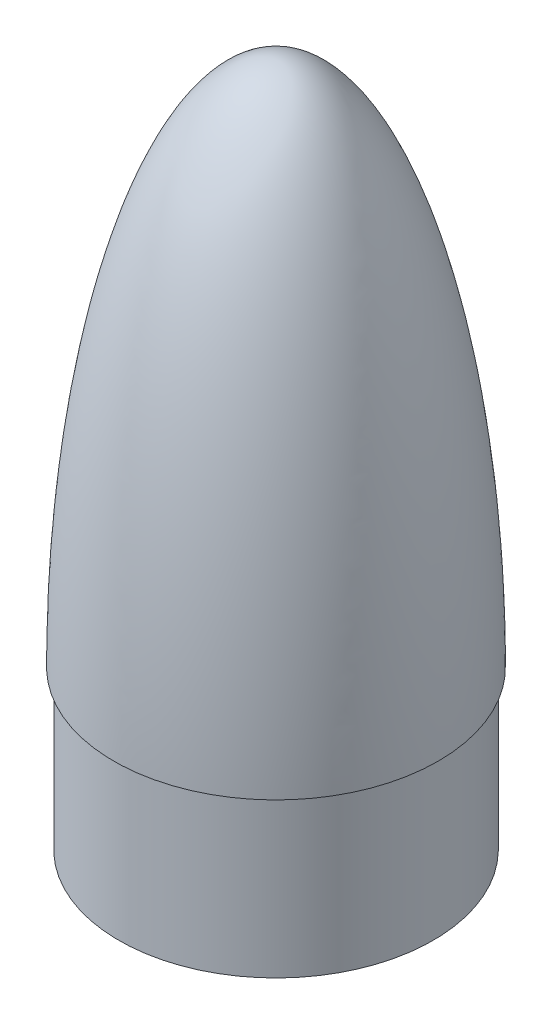
from build123d import *

# Parameters (mm, degrees)
SKETCH2_R           = 75.9206
BOSS_EXTRUDE1_DEPTH = 76.2
SKETCH4_R           = 17.78
CUT_EXTRUDE1_DEPTH  = 96.52
CUT_EXTRUDE2_START  = 106.68
SKETCH5_R           = 8.255
CUT_EXTRUDE2_DEPTH  = 119.38
CUT_EXTRUDE3_START  = -25.4
SKETCH19_R          = 15.24
CUT_EXTRUDE3_DEPTH  = 101.6
SKETCH21_R          = 2.6035
CUT_EXTRUDE4_DEPTH  = 10.16
SKETCH22_R          = 2.6035
CUT_EXTRUDE5_DEPTH  = 10.16


with BuildPart() as part:
    # Sketch1 → Revolve1 (revolve)
    with BuildSketch(Plane.XY):
        with BuildLine():
            Line((78.359, 0), (0, 0))
            Line((0, 0), (0, 254))
            add(Edge.make_bspline(
                [(78.359, 0), (78.359, 0.547287489), (78.357845602, 1.649563618), (78.352650776, 3.586349875), (78.338796346, 5.988934596), (78.318010672, 8.352211569), (78.29028895, 10.745600888), (78.246958697, 13.731411826), (78.181061307, 17.311703382), (78.08386626, 21.490442467), (77.944822085, 26.264117007), (77.777683186, 31.037557631), (77.58229134, 35.809557456), (77.358460439, 40.580511863), (77.042853487, 46.542286246), (76.679080298, 52.501436144), (76.266448568, 58.457359127), (75.804102806, 64.409607399), (75.404015228, 69.168949637), (74.865626928, 75.114798701), (74.157385744, 82.243973993), (73.238266918, 90.551730955), (72.055740597, 100.030771811), (70.735528943, 109.491671534), (69.270929118, 118.931305028), (67.249996919, 130.699881306), (64.501732948, 144.763840427), (61.308555538, 158.735984092), (57.591049496, 172.577213574), (53.383025938, 186.275905479), (49.238746312, 198.044837449), (44.48323743, 209.587335711), (38.942884235, 220.71924179), (34.256173135, 228.693595393), (29.818710248, 235.095423042), (25.624249732, 240.182852143), (21.978892835, 243.926180276), (18.570150197, 246.859542723), (15.474349081, 249.076247661), (12.563405711, 250.785701438), (9.772327363, 252.083533871), (7.063069709, 253.028642362), (4.275373805, 253.686778481), (2.188006886, 253.939891173), (0.767171586, 253.999916555), (0, 254)],
                knots=[0.083290168, 0.083290168, 0.083290168, 0.083290168, 0.083290168, 0.091119674, 0.09894918, 0.106778686, 0.114608192, 0.122437698, 0.130267203, 0.145926215, 0.161585227, 0.177244239, 0.192903251, 0.208562263, 0.224221275, 0.239880287, 0.27119831, 0.286857322, 0.302516334, 0.318175346, 0.333834359, 0.365152383, 0.396470407, 0.42778843, 0.459106453, 0.490424474, 0.521742495, 0.584378539, 0.647014581, 0.678332609, 0.709650637, 0.772286631, 0.810589211, 0.841907031, 0.872607503, 0.893486158, 0.91262845, 0.928287274, 0.941044948, 0.952387223, 0.962498308, 0.97249612, 0.981348672, 0.989949856, 1, 1, 1, 1, 1], degree=4))
        make_face()
    revolve(axis=Axis((0, 254, 0), (0, -1, 0)))

    # Sketch2 → Boss-Extrude1 (add)
    with BuildSketch(Plane.XZ):
        Circle(SKETCH2_R)
    extrude(amount=BOSS_EXTRUDE1_DEPTH)

    # Sketch4 → Cut-Extrude1 (cut)
    with BuildSketch(Plane(origin=(0, 0, 0), x_dir=(1, 0, 0), z_dir=(0, 1, 0))):
        with Locations((48.26, 0)):
            Circle(SKETCH4_R)
        with Locations((0, -48.26)):
            Circle(SKETCH4_R)
        with Locations((-48.26, 0)):
            Circle(SKETCH4_R)
        with Locations((0, 48.26)):
            Circle(SKETCH4_R)
    extrude(amount=CUT_EXTRUDE1_DEPTH, mode=Mode.SUBTRACT)

    # Sketch5 → Cut-Extrude2 (cut)
    with BuildSketch(Plane(origin=(0, 0, 0), x_dir=(1, 0, 0), z_dir=(0, 1, 0)).offset(CUT_EXTRUDE2_START)):
        with Locations((20.32, 0)):
            Circle(SKETCH5_R)
        with Locations((10.16, -17.597636205)):
            Circle(SKETCH5_R)
        with Locations((-10.16, -17.597636205)):
            Circle(SKETCH5_R)
        with Locations((-20.32, 0)):
            Circle(SKETCH5_R)
        with Locations((-10.16, 17.597636205)):
            Circle(SKETCH5_R)
        with Locations((10.16, 17.597636205)):
            Circle(SKETCH5_R)
    extrude(amount=CUT_EXTRUDE2_DEPTH, mode=Mode.SUBTRACT)

    # Sketch6 → Cut-Revolve2 (revolve, cut)
    with BuildSketch(Plane.XY):
        Polygon((-30.48, 96.52), (-48.26, 117.709378876), (-48.26, 96.52), align=None)
    revolve(axis=Axis((-48.26, 96.52, 0), (0, -1, 0)), mode=Mode.SUBTRACT)

    # Sketch8 → Cut-Revolve4 (revolve, cut)
    with BuildSketch(Plane.XY.offset(48.26)):
        Polygon((0, 96.52), (17.78, 96.52), (0, 117.709378876), align=None)
    revolve(axis=Axis((0, 96.52, 48.26), (0, -1, 0)), mode=Mode.SUBTRACT)

    # Sketch9 → Cut-Revolve5 (revolve, cut)
    with BuildSketch(Plane.XY):
        Polygon((48.26, 96.52), (66.04, 96.52), (48.26, 117.709378876), align=None)
    revolve(axis=Axis((48.26, 96.52, 0), (0, -1, 0)), mode=Mode.SUBTRACT)

    # Sketch11 → Cut-Revolve6 (revolve, cut)
    with BuildSketch(Plane.XY.offset(-48.26)):
        Polygon((0, 96.52), (17.78, 96.52), (0, 117.709378876), align=None)
    revolve(axis=Axis((0, 96.52, -48.26), (0, -1, 0)), mode=Mode.SUBTRACT)

    # Sketch12 → Cut-Revolve7 (revolve, cut)
    with BuildSketch(Plane.XY):
        Polygon((-20.32, 226.06), (-12.065, 226.06), (-20.32, 235.897925907), align=None)
    revolve(axis=Axis((-20.32, 226.06, 0), (0, -1, 0)), mode=Mode.SUBTRACT)

    # Sketch14 → Cut-Revolve8 (revolve, cut)
    with BuildSketch(Plane.XY):
        Polygon((20.32, 226.06), (28.575, 226.06), (20.32, 235.897925907), align=None)
    revolve(axis=Axis((20.32, 235.897925907, 0), (0, -1, 0)), mode=Mode.SUBTRACT)

    # Sketch15 → Cut-Revolve9 (revolve, cut)
    with BuildSketch(Plane.XY.offset(17.597636205)):
        Polygon((-10.16, 226.06), (-1.905, 226.06), (-10.16, 235.897925907), align=None)
    revolve(axis=Axis((-10.16, 226.06, 17.597636205), (0, -1, 0)), mode=Mode.SUBTRACT)

    # Sketch16 → Cut-Revolve10 (revolve, cut)
    with BuildSketch(Plane.XY.offset(17.597636205)):
        Polygon((10.16, 226.06), (18.415, 226.06), (10.16, 235.897925907), align=None)
    revolve(axis=Axis((10.16, 235.897925907, 17.597636205), (0, -1, 0)), mode=Mode.SUBTRACT)

    # Sketch17 → Cut-Revolve11 (revolve, cut)
    with BuildSketch(Plane.XY.offset(-17.597636205)):
        Polygon((10.16, 226.06), (18.415, 226.06), (10.16, 235.897925907), align=None)
    revolve(axis=Axis((10.16, 235.897925907, -17.597636205), (0, -1, 0)), mode=Mode.SUBTRACT)

    # Sketch18 → Cut-Revolve12 (revolve, cut)
    with BuildSketch(Plane.XY.offset(-17.597636205)):
        Polygon((-10.16, 226.06), (-1.905, 226.06), (-10.16, 235.897925907), align=None)
    revolve(axis=Axis((-10.16, 235.897925907, -17.597636205), (0, -1, 0)), mode=Mode.SUBTRACT)

    # Sketch19 → Cut-Extrude3 (cut)
    with BuildSketch(Plane(origin=(0, 0, 0), x_dir=(1, 0, 0), z_dir=(0, 1, 0)).offset(CUT_EXTRUDE3_START)):
        Circle(SKETCH19_R)
    extrude(amount=CUT_EXTRUDE3_DEPTH, mode=Mode.SUBTRACT)

    # Sketch20 → Cut-Revolve13 (revolve, cut)
    with BuildSketch(Plane.XY):
        Polygon((0, 76.2), (15.24, 76.2), (0, 94.362324751), align=None)
    revolve(axis=Axis((0, 270.51, 0), (0, -1, 0)), mode=Mode.SUBTRACT)

    # Sketch21 → Cut-Extrude4 (cut)
    with BuildSketch(Plane.XZ.offset(76.2)):
        with Locations((-37.81298, 0)):
            Circle(SKETCH21_R)
        with Locations((0, 37.81298)):
            Circle(SKETCH21_R)
        with Locations((37.81298, 0)):
            Circle(SKETCH21_R)
        with Locations((0, -37.81298)):
            Circle(SKETCH21_R)
    extrude(amount=-CUT_EXTRUDE4_DEPTH, mode=Mode.SUBTRACT)

    # Sketch22 → Cut-Extrude5 (cut)
    with BuildSketch(Plane.XZ.offset(76.2)):
        with Locations((-35.921024484, -35.921024484)):
            Circle(SKETCH22_R)
        with Locations((-35.921024484, 35.921024484)):
            Circle(SKETCH22_R)
        with Locations((35.921024484, 35.921024484)):
            Circle(SKETCH22_R)
        with Locations((35.921024484, -35.921024484)):
            Circle(SKETCH22_R)
    extrude(amount=-CUT_EXTRUDE5_DEPTH, mode=Mode.SUBTRACT)

    # Sketch3 → Cut-Revolve1 (revolve, cut)
    with BuildSketch(Plane.XY):
        with BuildLine():
            Line((0, 0), (50.695639171, 0))
            ThreePointArc((50.695639171, 0), (37.521185782, 66.292890616), (0, 122.510985441))
            Line((0, 122.510985441), (0, 0))
        make_face()
    revolve(axis=Axis((0, 270.51, 0), (0, -1, 0)), mode=Mode.SUBTRACT)


solid = part.part
